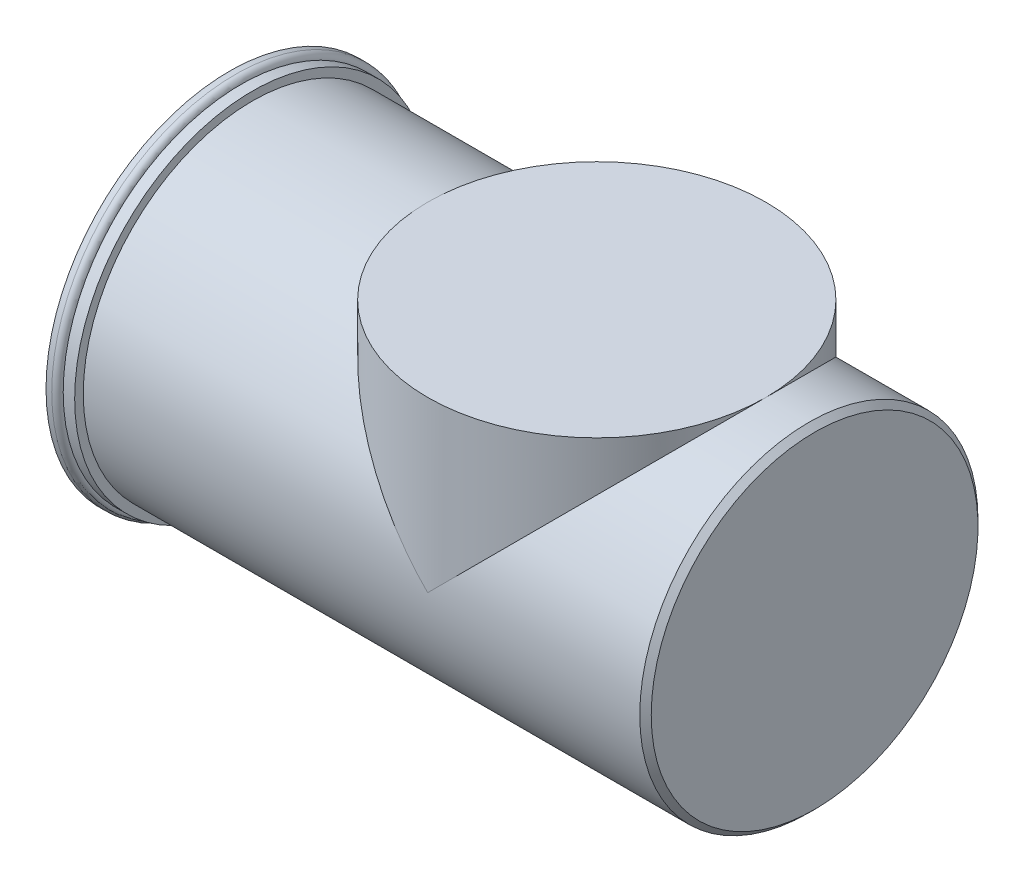
from build123d import *

# Parameters (mm, degrees)
SALIENTE_EXTRUIR3_DEPTH      = 96.52
SALIENTE_EXTRUIR3_DEPTH_BACK = 152.589992
CROQUIS3_R                   = 74.93
SALIENTE_EXTRUIR4_REACH      = 228.619
CROQUIS4_R                   = 74.93
CROQUIS5_R                   = 78.74
SALIENTE_EXTRUIR5_DEPTH      = 5.08
CROQUIS6_R                   = 81.28
SALIENTE_EXTRUIR6_DEPTH      = 5.08
REDONDEO1_R                  = 2.54
CHAFL_N1_SIZE                = 2.54


# Some blends are built 0.0001 mm under size
with BuildPart() as part:
    # Croquis3 → Saliente-Extruir3 (new, two sides: drawn at the far end of the back side and taken through both)
    with BuildSketch(Plane(origin=(0, 0, 0), x_dir=(0, 0, -1), z_dir=(1, 0, 0)).offset(-SALIENTE_EXTRUIR3_DEPTH_BACK)):
        Circle(CROQUIS3_R)
    extrude(amount=SALIENTE_EXTRUIR3_DEPTH + SALIENTE_EXTRUIR3_DEPTH_BACK)

    # Croquis4 → Saliente-Extruir4 (add, up to next)
    with BuildSketch(Plane(origin=(0, 74.93, 0), x_dir=(1, 0, 0), z_dir=(0, 1, 0)), mode=Mode.PRIVATE) as saliente_extruir4_sk1:
        Circle(CROQUIS4_R)
    saliente_extruir4_tool1 = extrude(saliente_extruir4_sk1.sketch, amount=-SALIENTE_EXTRUIR4_REACH, mode=Mode.PRIVATE) - part.part
    add(saliente_extruir4_tool1.solids().sort_by_distance((0, 74.93, 0))[0])
    add(saliente_extruir4_tool1.solids().sort_by_distance((0, 74.93, 0))[1])

    # Croquis5 → Saliente-Extruir5 (add)
    with BuildSketch(Plane.ZY.offset(152.589992)):
        Circle(CROQUIS5_R)
    extrude(amount=SALIENTE_EXTRUIR5_DEPTH)

    # Croquis6 → Saliente-Extruir6 (add)
    with BuildSketch(Plane.ZY.offset(157.669992)):
        Circle(CROQUIS6_R)
    extrude(amount=SALIENTE_EXTRUIR6_DEPTH)

    # Redondeo1
    redondeo1_edges = [part.edges().sort_by_distance(p)[0] for p in [
        (-157.669992, 0, -81.28),
    ]]
    fillet(redondeo1_edges, radius=REDONDEO1_R - 0.0001)  # a hair under: the kernel refuses the full size

    # Chaflán1
    # the kernel refuses this chamfer: 2.54 mm, written as the material it takes off along each edge
    with BuildSketch(Plane(origin=(96.52, 0, 0), x_dir=(0, 0, -1), z_dir=(0, -1, 0))) as chafl_n1_piece_1:
        Polygon((74.93, -CHAFL_N1_SIZE), (74.93 - CHAFL_N1_SIZE, 0), (74.93, 0), align=None)
    revolve(axis=Axis((96.52, 0, 0), (1, 0, 0)), mode=Mode.SUBTRACT)


solid = part.part
